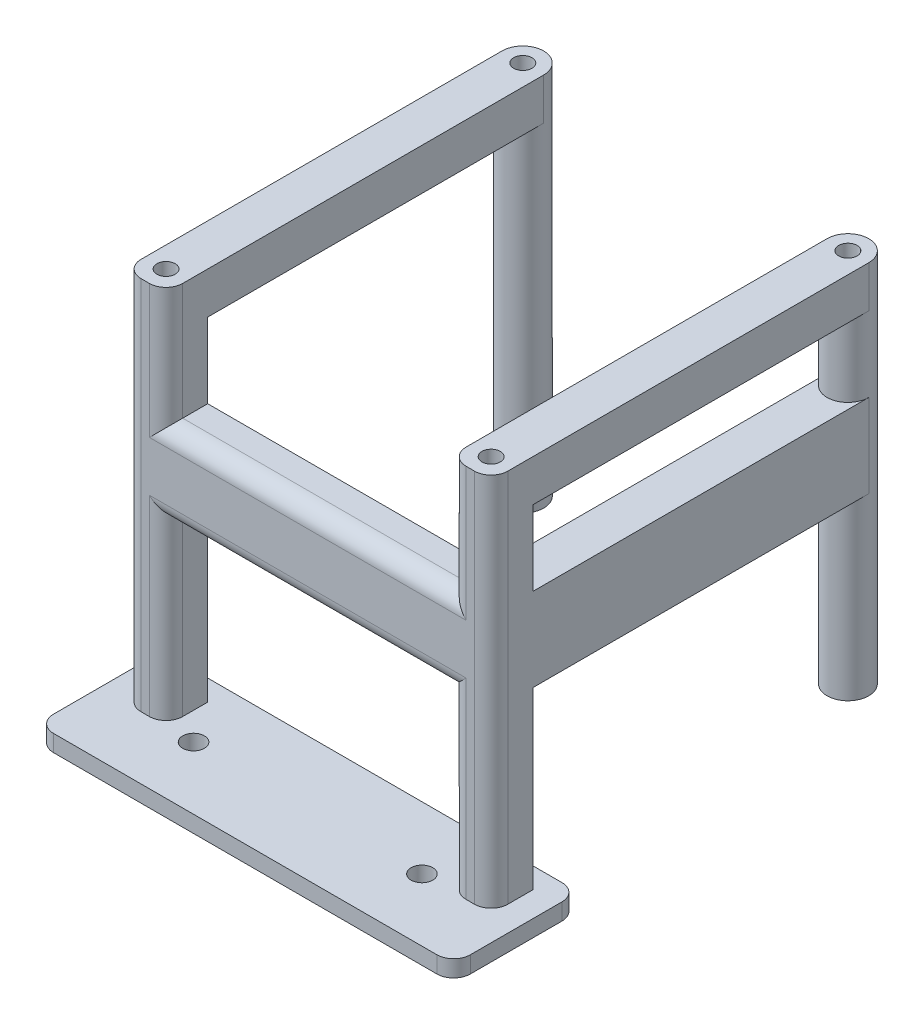
from build123d import *

# Parameters (mm, degrees)
SKETCH_1_W           = 50
SKETCH_1_H           = 15
SKETCH_1_R           = 1.3
EXTRUDE_1_DEPTH      = 2
SKETCH_2_R           = 2.5
SKETCH_2_R_2         = 1.1
EXTRUDE_2_DEPTH      = 45
EXTRUDE_2_2_DEPTH    = 45
EXTRUDE_START        = 42
EXTRUDE_3_DEPTH      = 5
SKETCH_4_W           = 5
SKETCH_4_H           = 5
EXTRUDE_4_DEPTH      = 40
SKETCH_5_R           = 1.1
CUT_EXTRUDE_1_DEPTH  = 10
EXTRUDE_5_REACH      = 70.307
EXTRUDE_5_END_RADIUS = 2.5
SKETCH_7_W           = 5
SKETCH_7_H           = 10
FILLET_1_R           = 2
EXTRUDE_6_REACH      = 81.107
SKETCH_8_W           = 5
SKETCH_8_H           = 10
FILLET_3_R           = 2


# Read off the part's stored shape, not the designer's step: 凸台-拉伸3
with BuildPart() as part:
    # 草图1 → 凸台-拉伸1 (new body)
    with BuildSketch(Plane(origin=(0, 0, 0), x_dir=(1, 0, 0), z_dir=(0, 1, 0))):
        Rectangle(SKETCH_1_W, SKETCH_1_H)
        with Locations(Location((-13.7, 0, 0), (0, 0, 270))):
            Circle(SKETCH_1_R, mode=Mode.SUBTRACT)
        with Locations(Location((13.7, 0, 0), (0, 0, 270))):
            Circle(SKETCH_1_R, mode=Mode.SUBTRACT)
    extrude(amount=EXTRUDE_1_DEPTH)



with BuildPart() as body_2:
    # 草图2 → 凸台-拉伸2 (new body)
    with BuildSketch(Plane(origin=(0, 2, 0), x_dir=(1, 0, 0), z_dir=(0, 1, 0))):
        with Locations(Location((19.5, 45.3, 0), (0, 0, 90))):
            Circle(SKETCH_2_R)
        with Locations(Location((19.5, 45.3, 0), (0, 0, 90))):
            Circle(SKETCH_2_R_2, mode=Mode.SUBTRACT)
    extrude(amount=EXTRUDE_2_DEPTH)



with BuildPart() as body_3:
    # 草图2 → Extrude 2 2 (new body)
    with BuildSketch(Plane(origin=(0, 2, 0), x_dir=(1, 0, 0), z_dir=(0, 1, 0))):
        with Locations(Location((-19.5, 45.3, 0), (0, 0, 90))):
            Circle(SKETCH_2_R)
        with Locations(Location((-19.5, 45.3, 0), (0, 0, 90))):
            Circle(SKETCH_2_R_2, mode=Mode.SUBTRACT)
    extrude(amount=EXTRUDE_2_2_DEPTH)


with BuildPart() as body_2_1:
    add(body_2.part)

    add(body_3.part)  # 凸台-拉伸3 merges body 3
    # 凸台-拉伸3 outline → 凸台-拉伸3 (add)
    with BuildSketch(Plane(origin=(0, 0, 0), x_dir=(1, 0, 0), z_dir=(0, 1, 0)).offset(EXTRUDE_START)):
        with BuildLine():
            Line((-22, 0), (-17, 0))
            Line((-17, 0), (-17, 45.3))
            ThreePointArc((-17, 45.3), (-19.5, 42.8), (-22, 45.3))
            Line((-22, 45.3), (-22, 0))
        make_face()
        with BuildLine():
            Line((17, 45.3), (17, 0))
            Line((17, 0), (22, 0))
            Line((22, 0), (22, 45.3))
            ThreePointArc((22, 45.3), (19.5, 42.8), (17, 45.3))
        make_face()
    extrude(amount=EXTRUDE_3_DEPTH)


with BuildPart() as part_1:
    add(part.part)

    add(body_2_1.part)  # 凸台-拉伸4 merges body 2
    # 草图4 → 凸台-拉伸4 (add)
    with BuildSketch(Plane.XZ.offset(-42)):
        with Locations((19.5, -2.5)):
            Rectangle(SKETCH_4_W, SKETCH_4_H)
        with Locations((-19.5, -2.5)):
            Rectangle(SKETCH_4_W, SKETCH_4_H)
    extrude(amount=EXTRUDE_4_DEPTH)

    # 草图5 → 切除-拉伸1 (cut)
    with BuildSketch(Plane(origin=(0, 47, 0), x_dir=(1, 0, 0), z_dir=(0, 1, 0))):
        with Locations(Location((-19.5, 2.5, 0), (0, 0, 270))):
            Circle(SKETCH_5_R)
        with Locations(Location((19.5, 2.5, 0), (0, 0, 270))):
            Circle(SKETCH_5_R)
    extrude(amount=-CUT_EXTRUDE_1_DEPTH, mode=Mode.SUBTRACT)

    # 凸台-拉伸5: up to this cylinder (the profile starts outside it)
    extrude_5_end = Plane(origin=(19.5, 28, -45.3), z_dir=(0, -1, 0)) * Cylinder(EXTRUDE_5_END_RADIUS, 146.614, mode=Mode.PRIVATE)
    # 草图7 → 凸台-拉伸5 (add, up to the surface)
    with BuildSketch(Plane(origin=(0, 0, -5), x_dir=(-1, 0, 0), z_dir=(0, 0, -1)), mode=Mode.PRIVATE) as extrude_5_sk1:
        with Locations((-19.5, 28)):
            Rectangle(SKETCH_7_W, SKETCH_7_H)
    extrude_5_tool1 = extrude(extrude_5_sk1.sketch, amount=EXTRUDE_5_REACH, mode=Mode.PRIVATE) - extrude_5_end
    add(extrude_5_tool1.solids().sort_by_distance((19.5, 28, -5))[0])

    # 圆角1
    fillet_1_edges = [part_1.edges().sort_by_distance(p)[0] for p in [
        (25, 1, 7.5),
        (-25, 1, 7.5),
        (-25, 1, -7.5),
        (25, 1, -7.5),
    ]]
    fillet(fillet_1_edges, radius=FILLET_1_R)

    # 草图8 → 凸台-拉伸6 (add, up to next)
    with BuildSketch(Plane(origin=(-17, 0, 0), x_dir=(0, 0, -1), z_dir=(1, 0, 0)), mode=Mode.PRIVATE) as extrude_6_sk1:
        with Locations((2.5, 28)):
            Rectangle(SKETCH_8_W, SKETCH_8_H)
    extrude_6_tool1 = extrude(extrude_6_sk1.sketch, amount=EXTRUDE_6_REACH, mode=Mode.PRIVATE) - part_1.part
    add(extrude_6_tool1.solids().sort_by_distance((-17, 28, -2.5))[0])

    # 圆角3
    fillet_3_edges = [part_1.edges().sort_by_distance(p)[0] for p in [
        (-17, 40, 0),
        (17, 40, 0),
        (0, 23, 0),
        (0, 33, 0),
        (17, 12.5, 0),
        (22, 24.5, 0),
        (-22, 24.5, 0),
        (-17, 12.5, 0),
    ]]
    fillet(fillet_3_edges, radius=FILLET_3_R)


solid = part_1.part
